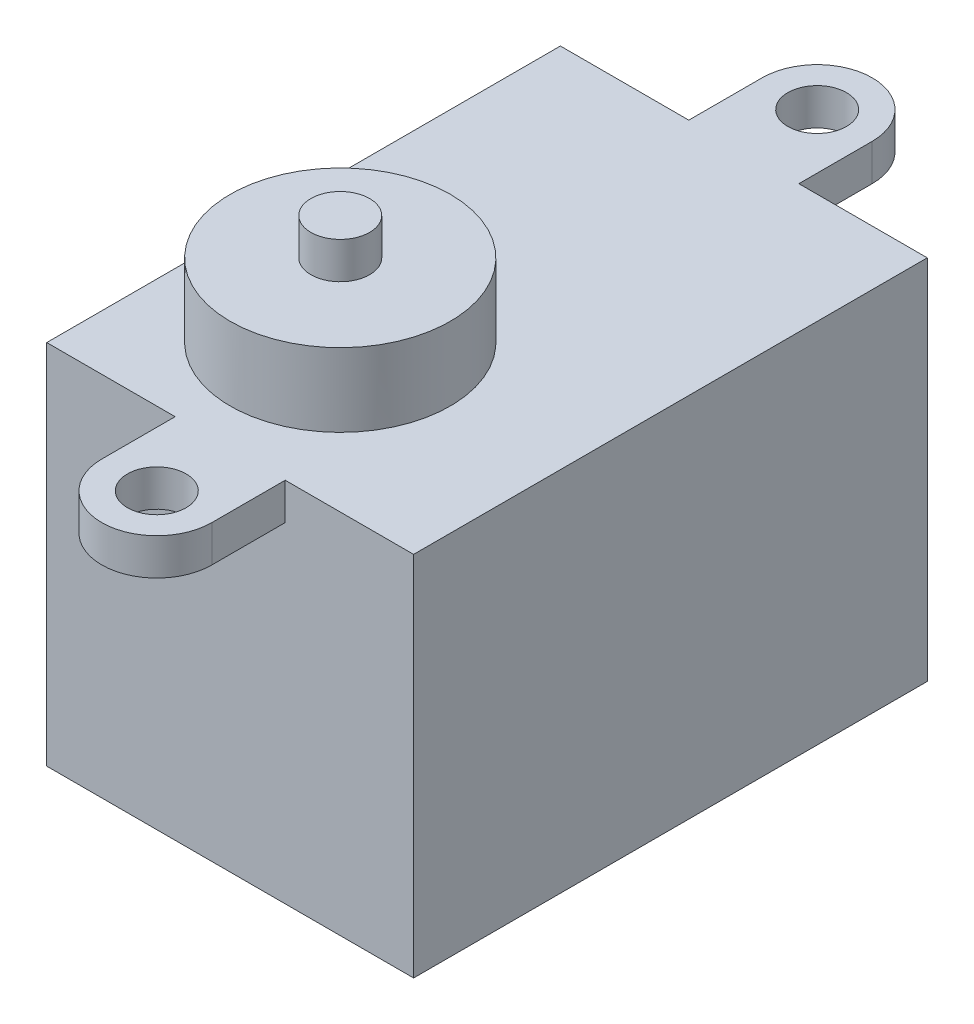
from build123d import *

# Parameters (mm, degrees)
SKETCH1_W           = 50
SKETCH1_H           = 70
BOSS_EXTRUDE1_DEPTH = 50
SKETCH2_R           = 15
BOSS_EXTRUDE2_DEPTH = 10
SKETCH3_R           = 4
BOSS_EXTRUDE3_DEPTH = 5
SHELL7_START        = 2
SHELL7_OUTLINE_W    = 46
SHELL7_OUTLINE_H    = 66
SHELL7_DEPTH        = 46
SHELL7_START_2      = 48
SHELL7_2_OUTLINE_R  = 13
SHELL7_2_DEPTH      = 10
SHELL7_START_3      = 58
SHELL7_3_OUTLINE_R  = 2
SHELL7_3_DEPTH      = 5
SKETCH4_R           = 4
BOSS_EXTRUDE4_DEPTH = 5
SCALE1_SCALE        = 0.5


# Read off the part's stored shape, not the designer's step: Shell7
with BuildPart() as part:
    # Sketch1 → Boss-Extrude1 (new body)
    with BuildSketch(Plane(origin=(0, 0, 0), x_dir=(1, 0, 0), z_dir=(0, 1, 0))):
        with Locations((25, 35)):
            Rectangle(SKETCH1_W, SKETCH1_H)
    extrude(amount=BOSS_EXTRUDE1_DEPTH)

    # Sketch2 → Boss-Extrude2 (add)
    with BuildSketch(Plane(origin=(0, 50, 0), x_dir=(1, 0, 0), z_dir=(0, 1, 0))):
        with Locations(Location((20, 20, 0), (0, 0, 90))):
            Circle(SKETCH2_R)
    extrude(amount=BOSS_EXTRUDE2_DEPTH)

    # Sketch3 → Boss-Extrude3 (add)
    with BuildSketch(Plane(origin=(0, 60, 0), x_dir=(1, 0, 0), z_dir=(0, 1, 0))):
        with Locations(Location((20, 20, 0), (0, 0, 270))):
            Circle(SKETCH3_R)
    extrude(amount=BOSS_EXTRUDE3_DEPTH)

    # Shell7 outline → Shell7 (cut)
    with BuildSketch(Plane(origin=(0, 0, 0), x_dir=(1, 0, 0), z_dir=(0, 1, 0)).offset(SHELL7_START)):
        with Locations((25, 35)):
            Rectangle(SHELL7_OUTLINE_W, SHELL7_OUTLINE_H)
    extrude(amount=SHELL7_DEPTH, mode=Mode.SUBTRACT)

    # Shell7 2 outline → Shell7 2 (cut)
    with BuildSketch(Plane(origin=(0, 0, 0), x_dir=(1, 0, 0), z_dir=(0, 1, 0)).offset(SHELL7_START_2)):
        with Locations((20, 20)):
            Circle(SHELL7_2_OUTLINE_R)
    extrude(amount=SHELL7_2_DEPTH, mode=Mode.SUBTRACT)

    # Shell7 3 outline → Shell7 3 (cut)
    with BuildSketch(Plane(origin=(0, 0, 0), x_dir=(1, 0, 0), z_dir=(0, 1, 0)).offset(SHELL7_START_3)):
        with Locations((20, 20)):
            Circle(SHELL7_3_OUTLINE_R)
    extrude(amount=SHELL7_3_DEPTH, mode=Mode.SUBTRACT)

    # Sketch4 → Boss-Extrude4 (add)
    with BuildSketch(Plane(origin=(0, 50, 0), x_dir=(1, 0, 0), z_dir=(0, 1, 0))):
        with BuildLine():
            Line((17.5, 70), (32.5, 70))
            Line((32.5, 70), (32.5, 80))
            ThreePointArc((32.5, 80), (25, 87.5), (17.5, 80))
            Line((17.5, 80), (17.5, 70))
        make_face()
        with Locations(Location((25, 80, 0), (0, 0, 270))):
            Circle(SKETCH4_R, mode=Mode.SUBTRACT)
    boss_extrude4 = extrude(amount=-BOSS_EXTRUDE4_DEPTH)

    # Mirror1: Boss-Extrude4 across plane
    add(boss_extrude4.mirror(Plane(origin=(0, 0, -35), x_dir=(1, 0, 0), z_dir=(0, 0, -1))))


with BuildPart() as part_1:
    # Scale1: scaled about (24.751384616, 27.88242139, -34.254153849)
    add(part.part.scale(SCALE1_SCALE).moved(Location((12.375692308, 13.941210695, -17.127076924))))


solid = part_1.part
